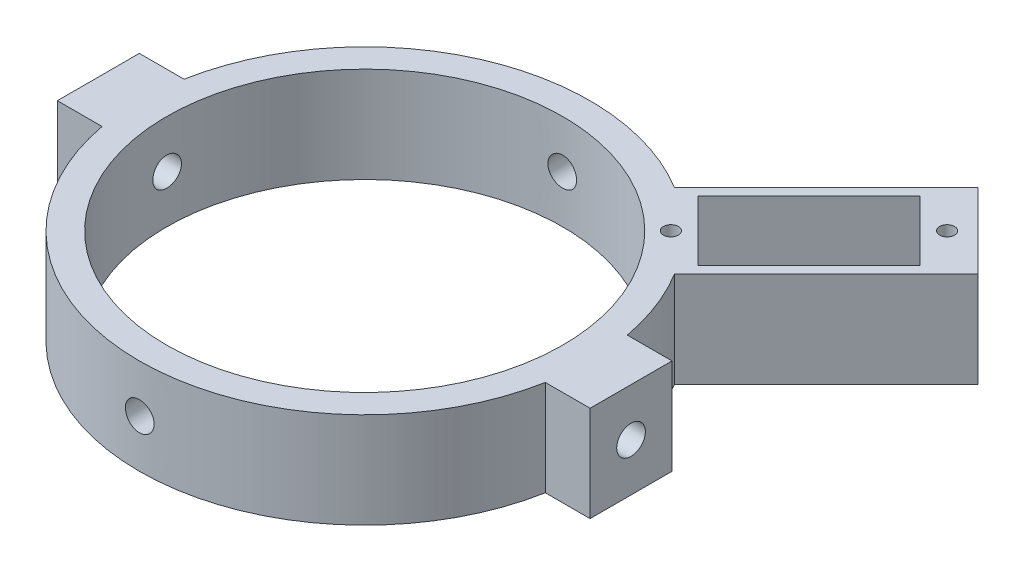
from build123d import *

# Parameters (mm, degrees)
SKETCH1_R               = 33
SKETCH1_R_2             = 29
BOSS_EXTRUDE1_DEPTH     = 7
SKETCH2_W               = 10
SKETCH2_H               = 12
BOSS_EXTRUDE2_DEPTH     = 7
SKETCH5_R               = 2.1
CUT_EXTRUDE1_DEPTH      = 85.982351109
CUT_EXTRUDE4_DEPTH      = 36.5
CUT_EXTRUDE4_DEPTH_BACK = 46.5
SKETCH7_R               = 2.1
BOSS_EXTRUDE4_DEPTH     = 7
SKETCH12_R              = 1.1
CUT_EXTRUDE6_DEPTH      = 73.61241287


with BuildPart() as part:
    # Sketch1 → Boss-Extrude1 (new, symmetric)
    with BuildSketch(Plane(origin=(0, 0, 0), x_dir=(1, 0, 0), z_dir=(0, 1, 0))):
        Circle(SKETCH1_R)
        Circle(SKETCH1_R_2, mode=Mode.SUBTRACT)
    extrude(amount=BOSS_EXTRUDE1_DEPTH, both=True)

    # Sketch2 → Boss-Extrude2 (add, symmetric)
    with BuildSketch(Plane(origin=(0, 0, 0), x_dir=(1, 0, 0), z_dir=(0, 1, 0))):
        with Locations((34, 0)):
            Rectangle(SKETCH2_W, SKETCH2_H)
        with Locations((-34, 0)):
            Rectangle(SKETCH2_W, SKETCH2_H)
    extrude(amount=BOSS_EXTRUDE2_DEPTH, both=True)

    # Sketch5 → Cut-Extrude1 (cut, through all)
    with BuildSketch(Plane.ZY.offset(39)):
        Circle(SKETCH5_R)
    extrude(amount=-CUT_EXTRUDE1_DEPTH, mode=Mode.SUBTRACT)

    # Sketch7 → Cut-Extrude4 (cut, two sides: drawn at the far end of the back side and taken through both)
    with BuildSketch(Plane.XY.offset(-CUT_EXTRUDE4_DEPTH_BACK)):
        Circle(SKETCH7_R)
    extrude(amount=CUT_EXTRUDE4_DEPTH + CUT_EXTRUDE4_DEPTH_BACK, mode=Mode.SUBTRACT)

    # Sketch11 → Boss-Extrude4 (add, symmetric)
    with BuildSketch(Plane(origin=(0, 0, 0), x_dir=(1, 0, 0), z_dir=(0, 1, 0))):
        Polygon((39.421203051, 50.38135816), (50.38135816, 39.421203051), (25.986174209, 15.0260191), (15.0260191, 25.986174209), align=None)
    extrude(amount=BOSS_EXTRUDE4_DEPTH, both=True)

    # Sketch12 → Cut-Extrude6 (cut, through all)
    with BuildSketch(Plane(origin=(0, 7, 0), x_dir=(1, 0, 0), z_dir=(0, 1, 0))):
        with Locations((22.415284964, 22.415284964)):
            Circle(SKETCH12_R)
        with Locations((42.638538906, 42.638538906)):
            Circle(SKETCH12_R)
        Polygon((28.814601333, 19.975766569), (19.975766569, 28.814601333), (36.239222536, 45.078057301), (45.078057301, 36.239222536), align=None)
    extrude(amount=-CUT_EXTRUDE6_DEPTH, mode=Mode.SUBTRACT)


solid = part.part
